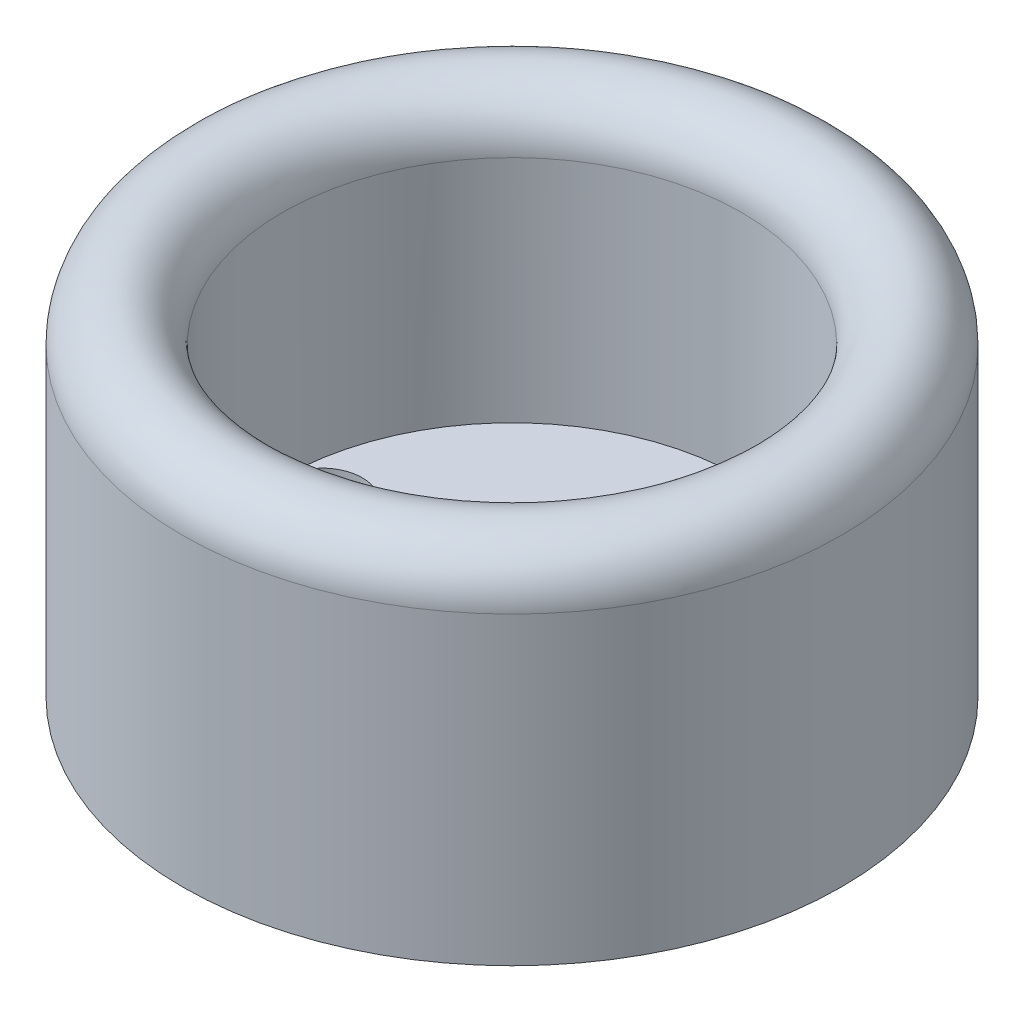
from build123d import *

# Parameters (mm, degrees)
SKETCH1_R           = 25
SKETCH1_R_2         = 1.8
SKETCH1_R_3         = 5.5
BOSS_EXTRUDE1_DEPTH = 7.5
SKETCH2_R           = 4
CUT_EXTRUDE1_DEPTH  = 6
SKETCH3_R           = 33
SKETCH3_R_2         = 23
BOSS_EXTRUDE2_DEPTH = 35.5
FILLET1_R           = 5


with BuildPart() as part:
    # Sketch1 → Boss-Extrude1 (new body)
    with BuildSketch(Plane(origin=(0, 0, 0), x_dir=(1, 0, 0), z_dir=(0, 1, 0))):
        with Locations(Location((0, 0, 0), (0, 0, 270))):
            Circle(SKETCH1_R)
        with Locations(Location((-19, 0, 0), (0, 0, 270))):
            Circle(SKETCH1_R_2, mode=Mode.SUBTRACT)
        with Locations(Location((19, 0, 0), (0, 0, 90))):
            Circle(SKETCH1_R_2, mode=Mode.SUBTRACT)
        with Locations(Location((0, 0, 0), (0, 0, 270))):
            Circle(SKETCH1_R_3, mode=Mode.SUBTRACT)
    extrude(amount=BOSS_EXTRUDE1_DEPTH)

    # Sketch2 → Cut-Extrude1 (cut)
    with BuildSketch(Plane(origin=(0, 7.5, 0), x_dir=(1, 0, 0), z_dir=(0, 1, 0))):
        with Locations(Location((-19, 0, 0), (0, 0, 270))):
            Circle(SKETCH2_R)
        with Locations(Location((19, 0, 0), (0, 0, 270))):
            Circle(SKETCH2_R)
    extrude(amount=-CUT_EXTRUDE1_DEPTH, mode=Mode.SUBTRACT)

    # Sketch3 → Boss-Extrude2 (add)
    with BuildSketch(Plane.XZ):
        with Locations(Location((0, 0, 0), (0, 0, 270))):
            Circle(SKETCH3_R)
        with Locations(Location((0, 0, 0), (0, 0, 270))):
            Circle(SKETCH3_R_2, mode=Mode.SUBTRACT)
    extrude(amount=-BOSS_EXTRUDE2_DEPTH)

    # Fillet1
    fillet1_edges = [part.edges().sort_by_distance(p)[0] for p in [
        (0, 35.5, 33),
        (0, 35.5, 23),
    ]]
    fillet(fillet1_edges, radius=FILLET1_R - 0.0001)  # a hair under: the kernel refuses the full size


solid = part.part
